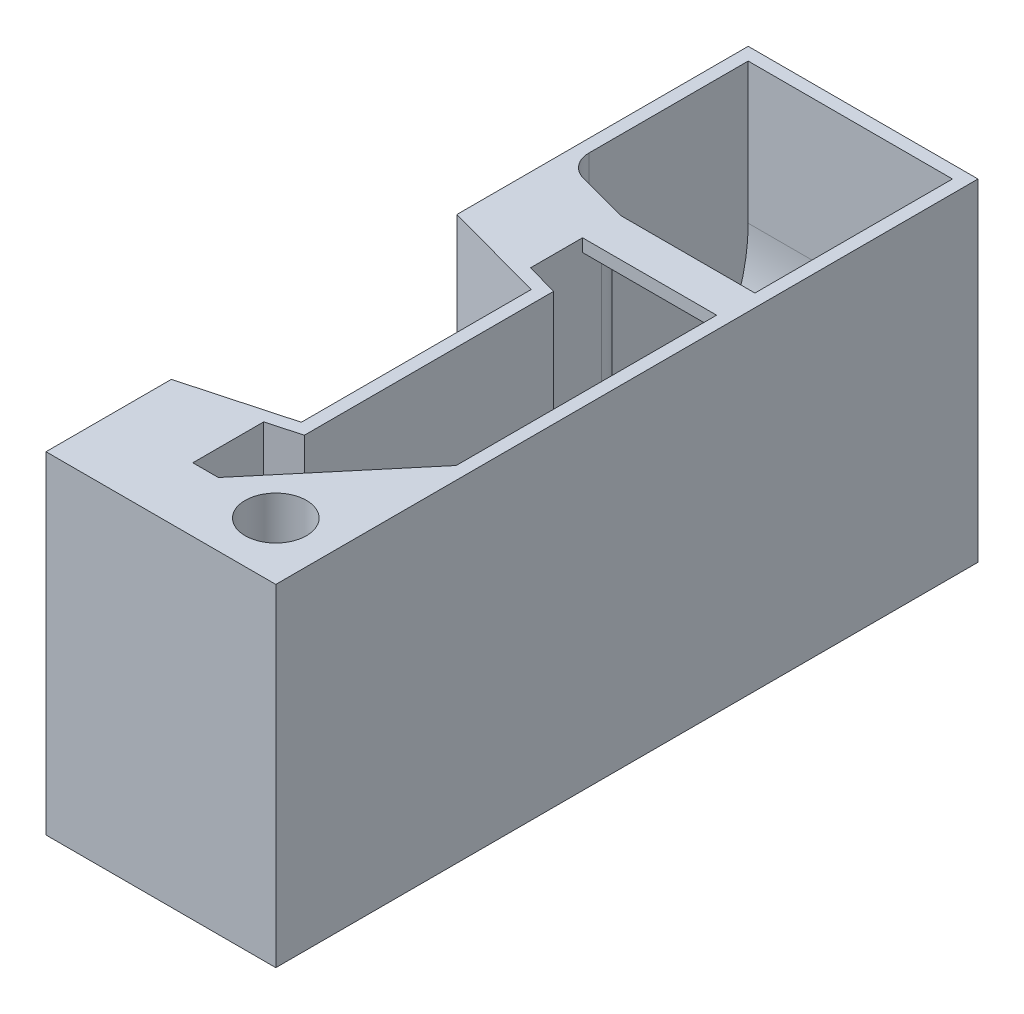
from build123d import *

# Parameters (mm, degrees)
BOSS_EXTRUDE2_DEPTH = 26
SHELL1_T            = -1
FILLET1_R           = 14
BOSS_EXTRUDE3_REACH = 52.259
FILLET2_R           = 14
SKETCH8_W           = 10.5
SKETCH8_H           = 3
BOSS_EXTRUDE4_DEPTH = 1
SKETCH4_R           = 2
CUT_EXTRUDE1_DEPTH  = 9
BOSS_EXTRUDE5_REACH = 52.259
SKETCH7_R           = 2.4
CUT_EXTRUDE2_DEPTH  = 4.7625
FILLET5_R           = 2


with BuildPart() as part:
    # Sketch2 → Boss-Extrude2 (new body)
    with BuildSketch(Plane.XZ):
        Polygon((7, -12.183821406), (7, -35), (25, -35), (25, 20), (7, 20), (7, 10.183821406), (15, 8), (15, -10), align=None)
    extrude(amount=BOSS_EXTRUDE2_DEPTH)

    # Shell1
    shell1_openings = [part.faces().sort_by_distance(p)[0] for p in [
        (17.00255576, 0, -8.766773004),
    ]]
    offset(amount=SHELL1_T, openings=shell1_openings, kind=Kind.INTERSECTION)

    # Fillet1
    fillet1_edges = [part.edges().sort_by_distance(p)[0] for p in [
        (16, -25, -34),
    ]]
    fillet(fillet1_edges, radius=FILLET1_R)

    # Sketch3 → Boss-Extrude3 (add, up to next)
    with BuildSketch(Plane(origin=(0, 0, 0), x_dir=(1, 0, 0), z_dir=(0, 1, 0)), mode=Mode.PRIVATE) as boss_extrude3_sk1:
        Polygon((13.5, 11.446055541), (8, 12.947432757), (8, 20), (13.5, 18.526279442), align=None)
    boss_extrude3_tool1 = extrude(boss_extrude3_sk1.sketch, amount=-BOSS_EXTRUDE3_REACH, mode=Mode.PRIVATE) - part.part
    # Sketch3 → Boss-Extrude3 (add, up to next)
    with BuildSketch(Plane(origin=(0, 0, 0), x_dir=(1, 0, 0), z_dir=(0, 1, 0)), mode=Mode.PRIVATE) as boss_extrude3_sk2:
        Polygon((13.5, -9.446055541), (8, -10.947432757), (8, -19), (13.5, -19), align=None)
    boss_extrude3_tool2 = extrude(boss_extrude3_sk2.sketch, amount=-BOSS_EXTRUDE3_REACH, mode=Mode.PRIVATE) - part.part
    add(boss_extrude3_tool1.solids().sort_by_distance((10.751794, 0, -15.729457))[0])
    add(boss_extrude3_tool2.solids().sort_by_distance((10.828168, 0, 14.587703))[0])

    # Fillet2
    # the kernel refuses this fillet: 14 mm, written as the material it adds along each edge
    with BuildSketch(Plane(origin=(24, 0, 19), x_dir=(0, 0, -1), z_dir=(0, -1, 0))) as fillet2_piece_1:
        with BuildLine():
            CenterArc((13.555441712, -14), FILLET2_R, 90, 75.522487814)
            Line((0, -10.5), (-0.271108834, -10.43))
            ThreePointArc((-0.271108834, -10.43), (-0.28, -5.25), (-0.28, 0))
            Line((-0.28, 0), (0, 0.28))
            Line((0, 0.28), (13.555441712, 0.28))
            Line((13.555441712, 0.28), (13.555441712, 0))
        make_face()
    extrude(amount=25)

    # Sketch8 → Boss-Extrude4 (add)
    with BuildSketch(Plane(origin=(0, 0, 0), x_dir=(1, 0, 0), z_dir=(0, 1, 0))):
        with Locations((18.75, 17.026279442)):
            Rectangle(SKETCH8_W, SKETCH8_H)
    extrude(amount=-BOSS_EXTRUDE4_DEPTH)

    # Sketch4 → Cut-Extrude1 (cut)
    with BuildSketch(Plane.ZY.offset(-7)):
        with Locations((-15, -23)):
            Circle(SKETCH4_R)
        with Locations((13, -23)):
            Circle(SKETCH4_R)
    extrude(amount=-CUT_EXTRUDE1_DEPTH, mode=Mode.SUBTRACT)

    # Sketch9 → Boss-Extrude5 (add, up to next)
    with BuildSketch(Plane(origin=(0, 0, 0), x_dir=(1, 0, 0), z_dir=(0, 1, 0)), mode=Mode.PRIVATE) as boss_extrude5_sk1:
        with BuildLine():
            Line((13.5, -15), (15.5, -15))
            Line((15.5, -15), (24, -4.870094463))
            Line((24, -4.870094463), (24, -5.444558288))
            ThreePointArc((24, -5.444558288), (21.067971811, -14.017772388), (13.5, -19))
            Line((13.5, -19), (13.5, -15))
        make_face()
    boss_extrude5_tool1 = extrude(boss_extrude5_sk1.sketch, amount=-BOSS_EXTRUDE5_REACH, mode=Mode.PRIVATE) - part.part
    add(boss_extrude5_tool1.solids().sort_by_distance((18.990726, 0, 13.031002))[0])

    # Sketch7 → Cut-Extrude2 (cut)
    with BuildSketch(Plane(origin=(0, 0, 0), x_dir=(1, 0, 0), z_dir=(0, 1, 0))):
        with Locations(Location((20.5, -15.5, 0), (0, 0, 270))):
            Circle(SKETCH7_R)
    extrude(amount=-CUT_EXTRUDE2_DEPTH, mode=Mode.SUBTRACT)

    # Fillet5
    fillet5_edges = [part.edges().sort_by_distance(p)[0] for p in [
        (8, -12.5, -20),
        (13.5, -13, -18.526279442),
    ]]
    fillet(fillet5_edges, radius=FILLET5_R)


solid = part.part
